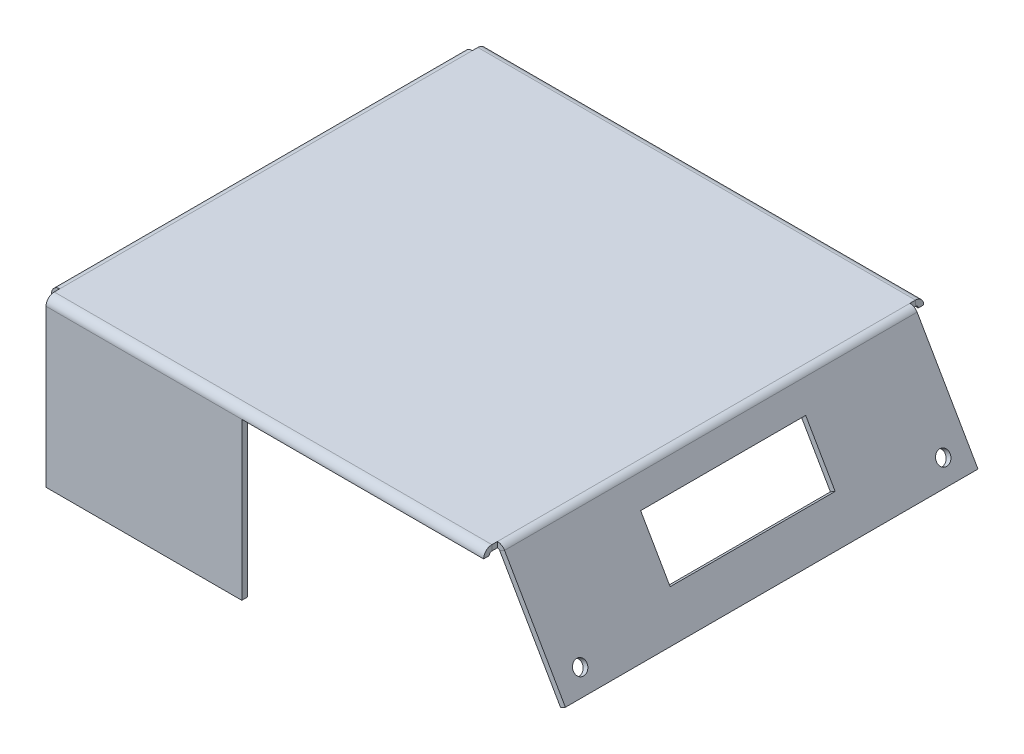
from build123d import *

# Parameters (mm, degrees)
SKETCH1_W                    = 160
SKETCH1_H                    = 150
BASE_FLANGE1_DEPTH           = 2
EDGE_FLANGE1_START           = -95
EDGE_FLANGE1_DEPTH           = 150
EDGE_FLANGE2_STRIP_W         = 20
EDGE_FLANGE2_STRIP_H         = 2
EDGE_FLANGE2_STRIP_CUT_DEPTH = 150
EDGE_FLANGE2_DEPTH           = 150
EDGE_FLANGE4_DEPTH           = 159.113248654
EDGE_FLANGE5_DEPTH           = 159.113248654
SKETCH32_W                   = 30
SKETCH32_H                   = 21.454922416
CUT_EXTRUDE2_DEPTH           = 10
SKETCH33_W                   = 87.917980444
SKETCH33_H                   = 57
CUT_EXTRUDE3_DEPTH           = 199.782165551
SKETCH38_R                   = 2.5
CUT_EXTRUDE5_DEPTH           = 2
SKETCH39_R                   = 2.5
CUT_EXTRUDE6_DEPTH           = 3


# Read off the part's stored shape, not the designer's step: Edge-Flange1
# Sheet-metal steps are written as plain solids
with BuildPart() as part:
    # Sketch1 → Base-Flange1 (new body)
    with BuildSketch(Plane(origin=(0, 0, 0), x_dir=(1, 0, 0), z_dir=(0, 1, 0))):
        with Locations((-5.285714286, 20)):
            Rectangle(SKETCH1_W, SKETCH1_H)
    extrude(amount=-BASE_FLANGE1_DEPTH)

    # Edge-Flange1 outline → Edge-Flange1 (add)
    with BuildSketch(Plane.XY.offset(EDGE_FLANGE1_START)):
        with BuildLine():
            Line((101.559585176, -39.837168574), (79.42561058, -1.5))
            ThreePointArc((79.42561058, -1.5), (78.327534368, -0.401923789), (76.827534368, 0))
            Line((76.827534368, 0), (74.714285714, 0))
            Line((74.714285714, 0), (74.714285714, -2))
            Line((74.714285714, -2), (76.827534368, -2))
            ThreePointArc((76.827534368, -2), (77.327534368, -2.133974596), (77.693559772, -2.5))
            Line((77.693559772, -2.5), (99.827534368, -40.837168574))
            Line((99.827534368, -40.837168574), (101.559585176, -39.837168574))
        make_face()
    extrude(amount=EDGE_FLANGE1_DEPTH)

    # Edge-Flange2 strip (across the edge) → Edge-Flange2 strip cut (cut)
    with BuildSketch(Plane(origin=(-85.285714286, -2, 55), x_dir=(1, 0, 0), z_dir=(0, 0, -1))):
        with Locations((-7, -1)):
            Rectangle(EDGE_FLANGE2_STRIP_W, EDGE_FLANGE2_STRIP_H)
    extrude(amount=EDGE_FLANGE2_STRIP_CUT_DEPTH, mode=Mode.SUBTRACT)

    # Edge-Flange2 section (across the edge) → Edge-Flange2 (add)
    with BuildSketch(Plane(origin=(-85.285714286, -2, 55), x_dir=(1, 0, 0), z_dir=(0, 0, -1))):
        with BuildLine():
            Line((0, 1), (0, 38))
            Line((0, 38), (2, 38))
            Line((2, 38), (2, 1))
            ThreePointArc((2, 1), (2.292893219, 0.292893219), (3, 0))
            Line((3, 0), (3, -2))
            ThreePointArc((3, -2), (0.878679656, -1.121320344), (0, 1))
        make_face()
    extrude(amount=EDGE_FLANGE2_DEPTH)

    # Edge-Flange4 section (across the edge) → Edge-Flange4 (add)
    with BuildSketch(Plane(origin=(76.827534368, -2, 60), x_dir=(0, 0, -1), z_dir=(-1, 0, 0))):
        with BuildLine():
            Line((0, 1), (0, 58))
            Line((0, 58), (2, 58))
            Line((2, 58), (2, 1))
            ThreePointArc((2, 1), (2.292893219, 0.292893219), (3, 0))
            Line((3, 0), (5, 0))
            Line((5, 0), (5, -2))
            Line((5, -2), (3, -2))
            ThreePointArc((3, -2), (0.878679656, -1.121320344), (0, 1))
        make_face()
    extrude(amount=EDGE_FLANGE4_DEPTH)

    # Edge-Flange5 section (across the edge) → Edge-Flange5 (add)
    with BuildSketch(Plane(origin=(-82.285714286, -2, -100), x_dir=(0, 0, 1), z_dir=(1, 0, 0))):
        with BuildLine():
            Line((0, 1), (0, 58))
            Line((0, 58), (2, 58))
            Line((2, 58), (2, 1))
            ThreePointArc((2, 1), (2.292893219, 0.292893219), (3, 0))
            Line((3, 0), (5, 0))
            Line((5, 0), (5, -2))
            Line((5, -2), (3, -2))
            ThreePointArc((3, -2), (0.878679656, -1.121320344), (0, 1))
        make_face()
    extrude(amount=EDGE_FLANGE5_DEPTH)

    # Sketch32 → Cut-Extrude2 (cut)
    with BuildSketch(Plane(origin=(58.919688882, 34.017298237, 0), x_dir=(0, 0, -1), z_dir=(0.8660254037844364, 0.5000000000000039, 0))):
        with Locations((5, -60.695720616)):
            Rectangle(SKETCH32_W, SKETCH32_H)
        with Locations((35, -60.695720616)):
            Rectangle(SKETCH32_W, SKETCH32_H)
    extrude(amount=-CUT_EXTRUDE2_DEPTH, mode=Mode.SUBTRACT)

    # Sketch33 → Cut-Extrude3 (cut, through all)
    with BuildSketch(Plane.XY.offset(60)):
        with Locations((32.868544146, -31.5)):
            Rectangle(SKETCH33_W, SKETCH33_H)
    extrude(amount=-CUT_EXTRUDE3_DEPTH, mode=Mode.SUBTRACT)

    # Sketch38 → Cut-Extrude5 (cut)
    with BuildSketch(Plane(origin=(58.919688882, 34.017298237, 0), x_dir=(0, 0, -1), z_dir=(0.8660254037844363, 0.5000000000000042, 0))):
        with Locations(Location((-46, -78, 0), (0, 0, 90))):
            Circle(SKETCH38_R)
        with Locations(Location((86, -78, 0), (0, 0, 270))):
            Circle(SKETCH38_R)
    extrude(amount=-CUT_EXTRUDE5_DEPTH, mode=Mode.SUBTRACT)

    # Sketch39 → Cut-Extrude6 (cut)
    with BuildSketch(Plane.ZY.offset(85.285714286)):
        with Locations(Location((46.11, -32.12, 0), (0, 0, 270))):
            Circle(SKETCH39_R)
        with Locations(Location((-86.11, -32.12, 0), (0, 0, 270))):
            Circle(SKETCH39_R)
    extrude(amount=-CUT_EXTRUDE6_DEPTH, mode=Mode.SUBTRACT)


solid = part.part
